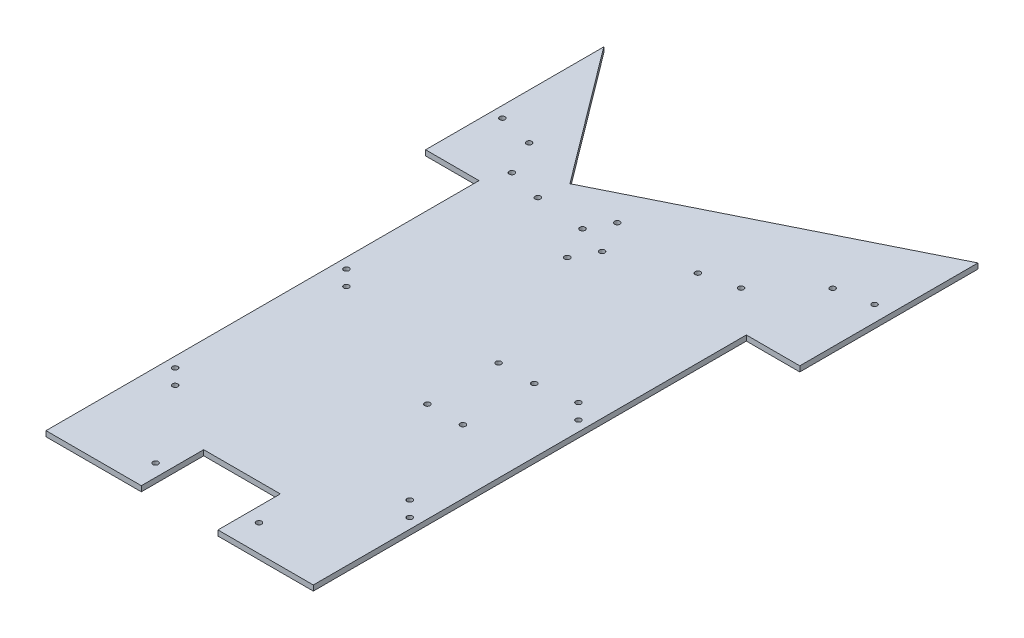
from build123d import *

# Parameters (mm, degrees)
SKETCH1_R           = 1.5
BOSS_EXTRUDE1_DEPTH = 3
SKETCH2_R           = 1.5
SKETCH2_R_2         = 1.500000004
SKETCH2_R_3         = 1.499999996
SKETCH2_R_4         = 1.499999997
BOSS_EXTRUDE3_DEPTH = 3


with BuildPart() as part:
    # Sketch1 → Boss-Extrude1 (new body)
    with BuildSketch(Plane(origin=(0, 0, 0), x_dir=(1, 0, 0), z_dir=(0, 1, 0))):
        Polygon((-75, -100), (-75, 100), (75, 100), (75, -100), (21.5, -100), (21.5, -65), (-21.5, -65), (-21.5, -100), align=None)
        with Locations((-69.242640687, 62.79605759)):
            Circle(SKETCH1_R, mode=Mode.SUBTRACT)
        with Locations((-60.757359313, 54.310776216)):
            Circle(SKETCH1_R, mode=Mode.SUBTRACT)
        with Locations((60.757359313, 63.034810844)):
            Circle(SKETCH1_R, mode=Mode.SUBTRACT)
        with Locations((69.242640687, 54.54952947)):
            Circle(SKETCH1_R, mode=Mode.SUBTRACT)
        with Locations((-69.242640687, -33.274226936)):
            Circle(SKETCH1_R, mode=Mode.SUBTRACT)
        with Locations((-60.757359313, -41.75950831)):
            Circle(SKETCH1_R, mode=Mode.SUBTRACT)
        with Locations((60.757359313, -31.641853854)):
            Circle(SKETCH1_R, mode=Mode.SUBTRACT)
        with Locations((69.242640687, -40.127135228)):
            Circle(SKETCH1_R, mode=Mode.SUBTRACT)
        with Locations((19.1, 59.87604307)):
            Circle(SKETCH1_R, mode=Mode.SUBTRACT)
        with Locations((39.1, 19.87604307)):
            Circle(SKETCH1_R, mode=Mode.SUBTRACT)
        with Locations((19.1, 19.87604307)):
            Circle(SKETCH1_R, mode=Mode.SUBTRACT)
        with Locations((39.1, 59.87604307)):
            Circle(SKETCH1_R, mode=Mode.SUBTRACT)
        with Locations((-28.5, -85)):
            Circle(SKETCH1_R, mode=Mode.SUBTRACT)
        with Locations((29.5, -85)):
            Circle(SKETCH1_R, mode=Mode.SUBTRACT)
    extrude(amount=BOSS_EXTRUDE1_DEPTH)

    # Sketch2 → Boss-Extrude3 (add)
    with BuildSketch(Plane(origin=(0, 3, 0), x_dir=(1, 0, 0), z_dir=(0, 1, 0))):
        Polygon((-75, 100), (-75, 143), (-105, 143), (-105, 243), (-48, 167), (105, 243), (105, 143), (75, 143), (75, 100), align=None)
        with Locations((-12.871401164, 130.377195869)):
            Circle(SKETCH2_R, mode=Mode.SUBTRACT)
        with Locations((-6.031802552, 143.074435365)):
            Circle(SKETCH2_R, mode=Mode.SUBTRACT)
        with Locations((-15.737183302, 161.327601796)):
            Circle(SKETCH2_R, mode=Mode.SUBTRACT)
        with Locations((-22.576781914, 148.6303623)):
            Circle(SKETCH2_R, mode=Mode.SUBTRACT)
        with Locations((31.340042847, 159.444468604)):
            Circle(SKETCH2_R_2, mode=Mode.SUBTRACT)
        with Locations((50.742574777, 164.29645322)):
            Circle(SKETCH2_R_2, mode=Mode.SUBTRACT)
        with Locations((76.536595954, 189.883247412)):
            Circle(SKETCH2_R_2, mode=Mode.SUBTRACT)
        with Locations((96.155699061, 193.767934436)):
            Circle(SKETCH2_R_2, mode=Mode.SUBTRACT)
        with Locations((-50.270108513, 151.236438256)):
            Circle(SKETCH2_R_3, mode=Mode.SUBTRACT)
        with Locations((-69.672640443, 156.088422871)):
            Circle(SKETCH2_R_3, mode=Mode.SUBTRACT)
        with Locations((-79.321204369, 175.416451104)):
            Circle(SKETCH2_R_4, mode=Mode.SUBTRACT)
        with Locations((-98.81252438, 179.898464514)):
            Circle(SKETCH2_R_4, mode=Mode.SUBTRACT)
    extrude(amount=-BOSS_EXTRUDE3_DEPTH)


solid = part.part
